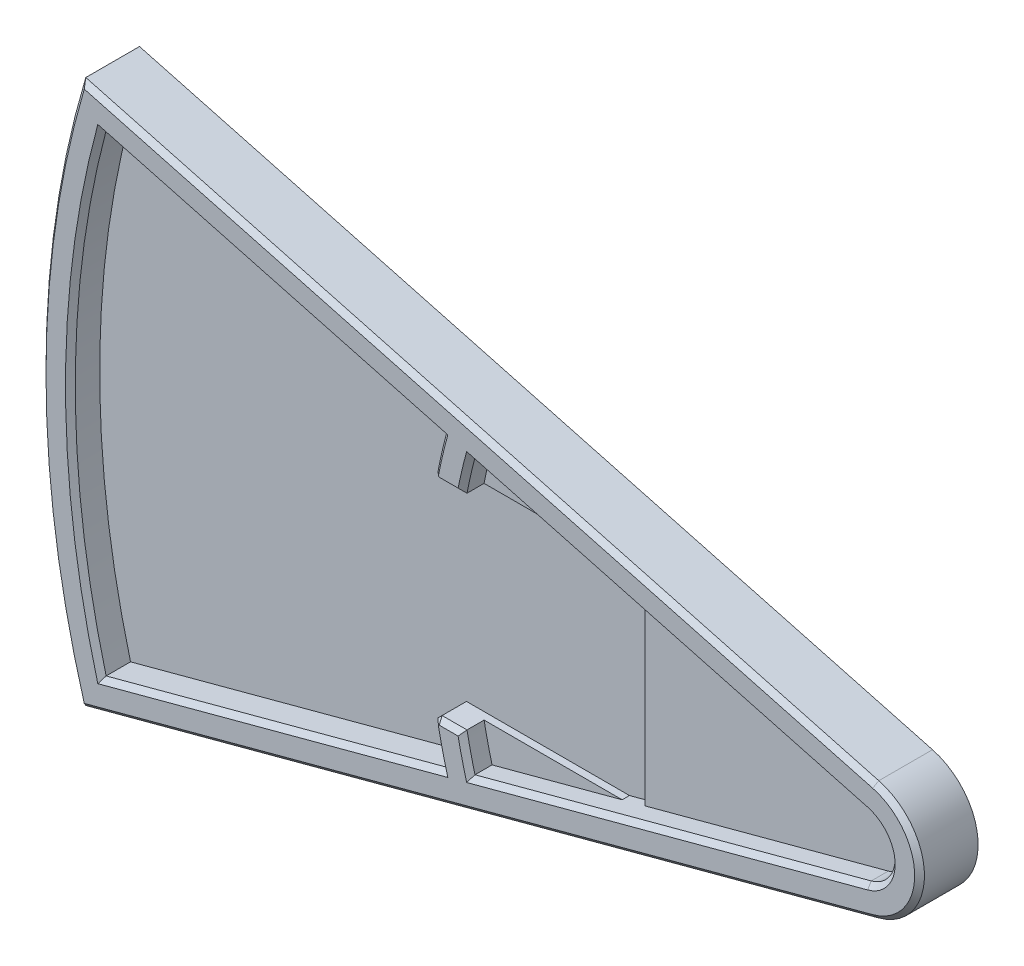
from build123d import *

# Parameters (mm, degrees)
BOSS_EXTRUDE1_DEPTH = 6
BOSS_EXTRUDE2_START = 6
BOSS_EXTRUDE2_DEPTH = 6
BOSS_EXTRUDE3_DEPTH = 1.5
CUT_EXTRUDE3_DEPTH  = 6
CHAMFER1_SIZE       = 0.858848527
CHAMFER1_SIZE_2     = 1
CHAMFER2_SIZE       = 1


with BuildPart() as part:
    # Sketch3 → Boss-Extrude1 (new body)
    with BuildSketch(Plane.XY):
        with BuildLine():
            Line((3.263957589, 12.181255556), (-159.230871571, 55.721613803))
            ThreePointArc((-159.230871571, 55.721613803), (-167.389036276, 0), (-159.230871571, -55.721613803))
            Line((-159.230871571, -55.721613803), (-83.597968128, -35.455838404))
            Line((-83.597968128, -35.455838404), (3.263957589, -12.181255556))
            ThreePointArc((3.263957589, -12.181255556), (12.610963724, 0), (3.263957589, 12.181255556))
        make_face()
    extrude(amount=BOSS_EXTRUDE1_DEPTH)

    # Sketch3<3> → Boss-Extrude2 (add)
    with BuildSketch(Plane.XY.offset(BOSS_EXTRUDE2_START)):
        with BuildLine():
            ThreePointArc((3.263957589, -12.181255556), (12.610963724, 0), (3.263957589, 12.181255556))
            Line((3.263957589, 12.181255556), (-159.230871571, 55.721613803))
            ThreePointArc((-159.230871571, 55.721613803), (-167.389036276, 0), (-159.230871571, -55.721613803))
            Line((-159.230871571, -55.721613803), (-83.597968128, -35.455838404))
            Line((-83.597968128, -35.455838404), (3.263957589, -12.181255556))
        make_face()
        with BuildLine():
            Line((-85.282065581, -29.695433875), (-155.066564747, -48.39413407))
            ThreePointArc((-155.066564747, -48.39413407), (-161.389036276, 0), (-155.066564747, 48.39413407))
            Line((-155.066564747, 48.39413407), (-85.282065581, 29.695433875))
            ThreePointArc((-85.282065581, 29.695433875), (-89.143036276, 0), (-85.282065581, -29.695433875))
        make_face(mode=Mode.SUBTRACT)
        with BuildLine():
            Line((1.711043318, -6.385700598), (-79.486479098, -28.142511157))
            ThreePointArc((-79.486479098, -28.142511157), (-83.143036276, 0), (-79.486479098, 28.142511157))
            Line((-79.486479098, 28.142511157), (1.711043318, 6.385700598))
            ThreePointArc((1.711043318, 6.385700598), (6.610963724, 0), (1.711043318, -6.385700598))
        make_face(mode=Mode.SUBTRACT)
    extrude(amount=BOSS_EXTRUDE2_DEPTH)

    # Sketch4 → Boss-Extrude3 (add)
    with BuildSketch(Plane.XY.offset(6)):
        with BuildLine():
            ThreePointArc((-79.486479098, 28.142511157), (-80.363791639, 24.584864194), (-81.12226241, 21))
            Line((-81.12226241, 21), (-52.830264568, 21))
            Line((-52.830264568, 21), (-79.486479098, 28.142511157))
        make_face()
        with BuildLine():
            Line((-79.486479098, -28.142511157), (-52.830264568, -21))
            Line((-52.830264568, -21), (-81.12226241, -21))
            ThreePointArc((-81.12226241, -21), (-80.363791639, -24.584864194), (-79.486479098, -28.142511157))
        make_face()
        with BuildLine():
            Line((-48.09821376, 19.732050808), (-48.09821376, -19.732050808))
            Line((-48.09821376, -19.732050808), (1.711043318, -6.385700598))
            ThreePointArc((1.711043318, -6.385700598), (6.610963724, 0), (1.711043318, 6.385700598))
            Line((1.711043318, 6.385700598), (-48.09821376, 19.732050808))
        make_face()
    extrude(amount=BOSS_EXTRUDE3_DEPTH)

    # Sketch5 → Cut-Extrude3 (cut)
    with BuildSketch(Plane.XY.offset(6)):
        with BuildLine():
            Line((-81.12226241, 21), (-87.228470489, 21))
            ThreePointArc((-87.228470489, 21), (-89.143036276, 0), (-87.228470489, -21))
            Line((-87.228470489, -21), (-81.12226241, -21))
            ThreePointArc((-81.12226241, -21), (-83.143036276, 0), (-81.12226241, 21))
        make_face()
    extrude(amount=CUT_EXTRUDE3_DEPTH, mode=Mode.SUBTRACT)

    # Chamfer1
    # the kernel refuses this chamfer: 1, 0.858848527 mm, written as the material it takes off along each edge
    with BuildSketch(Plane(origin=(-87.228470489, 21, 6), x_dir=(0.1850514416549976, 0.9827288354075131, 0), z_dir=(0, 0, 1))) as chamfer1_piece_1:
        with BuildLine():
            Line((0.995740125, 0), (CHAMFER1_SIZE * 0.185051441724, -CHAMFER1_SIZE * 0.982728835776))
            Line((CHAMFER1_SIZE * 0.185051441724, -CHAMFER1_SIZE * 0.982728835776), (0, 0))
            ThreePointArc((0, 0), (0.511949844, 0.001066408), (0.995740125, 0))
        make_face()
    extrude(amount=8.560742024, mode=Mode.SUBTRACT)
    with BuildSketch(Plane(origin=(-87.228470489, -21, 6), x_dir=(1, 0, 0), z_dir=(0, 0, 1))) as chamfer1_piece_2:
        with BuildLine():
            Line((CHAMFER1_SIZE_2, 0), (0.158025015, -0.841974985))
            ThreePointArc((0.158025015, -0.841974985), (0.080319075, -0.432228603), (0, 0))
            Line((0, 0), (CHAMFER1_SIZE_2, 0))
        make_face()
    extrude(amount=8.571682988, mode=Mode.SUBTRACT)

    # Chamfer2
    chamfer2_edges = [part.edges().sort_by_distance(p)[0] for p in [
        (-86.244364999, -25.784214234, 12),
        (-83.67536645, -21, 12),
        (-86.706914653, 21.489271267, 12),
        (-86.649457982, -21.420987493, 12),
        (-86.228906055, 25.852006602, 12),
        (-120.174315164, -39.044783972, 12),
        (12.610963724, 0, 12),
        (-167.389036276, 0, 12),
        (-38.88771789, 17.264105877, 12),
        (-38.88771789, -17.264105877, 12),
        (-77.983456991, 33.951434679, 12),
        (-77.983456991, -33.951434679, 12),
        (-120.174315164, 39.044783972, 12),
        (-161.389036276, 0, 12),
        (6.610963724, 0, 12),
        (-80.363791639, 24.584864194, 12),
        (-80.363791639, -24.584864194, 12),
        (-83.745942186, 21, 12),
    ]]
    chamfer(chamfer2_edges, length=CHAMFER2_SIZE)


solid = part.part
